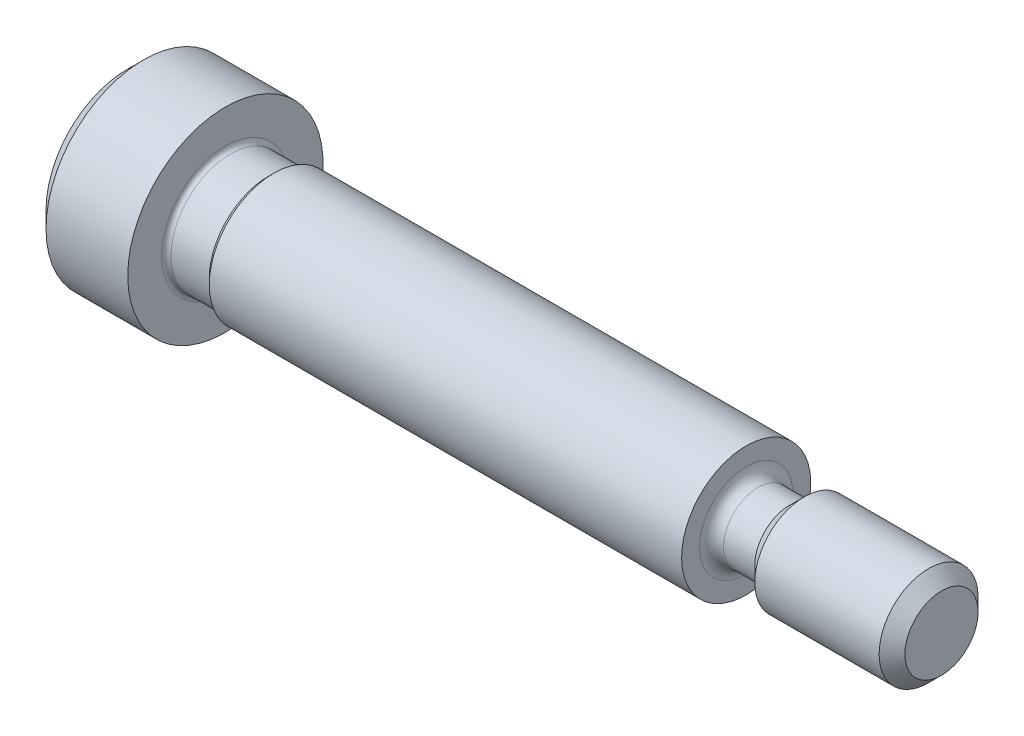
from build123d import *

# Parameters (mm, degrees)
HEX_2_DEPTH = 2.3876


# Read off the part's stored shape, not the designer's step: ThreadSchematic
with BuildPart() as part:
    # ThreadSchematic outline → ThreadSchematic (revolve)
    with BuildSketch(Plane.YX):
        with BuildLine():
            Line((0, 39.7002), (0, 0))
            Line((0, 0), (3.9751, 0))
            Line((3.9751, 0), (4.7625, 0.7874))
            Line((4.7625, 0.7874), (4.7625, 4.7752))
            Line((4.7625, 4.7752), (3.1115, 4.7752))
            ThreePointArc((3.1115, 4.7752), (2.94985539, 4.84215539), (2.8829, 5.0038))
            Line((2.8829, 5.0038), (2.8829, 6.8707))
            Line((2.8829, 6.8707), (3.1496, 7.1374))
            Line((3.1496, 7.1374), (3.1496, 30.1752))
            Line((3.1496, 30.1752), (2.2733, 30.1752))
            ThreePointArc((2.2733, 30.1752), (1.860208218, 30.346308218), (1.6891, 30.7594))
            Line((1.6891, 30.7594), (1.6891, 32.2834))
            Line((1.6891, 32.2834), (2.413, 33.0073))
            Line((2.413, 33.0073), (2.413, 39.07028))
            Line((2.413, 39.07028), (1.78308, 39.7002))
            Line((1.78308, 39.7002), (0, 39.7002))
        make_face()
    revolve(axis=Axis((0, 0, 0), (1, 0, 0)))

    # Sketch2 → PreBroach (revolve, cut)
    with BuildSketch(Plane.XY, mode=Mode.PRIVATE) as prebroach_sk:
        Polygon((0, 1.5875), (2.3876, 1.5875), (3.304143552, 0), (0, 0), align=None)
    revolve(prebroach_sk.sketch.rotate(Axis((0, 0, 0), (1, 0, 0)), 90), axis=Axis((0, 0, 0), (1, 0, 0)), mode=Mode.SUBTRACT)

    # Sketch3 → Hex 2 (cut)
    with BuildSketch(Plane.ZY):
        Polygon((-1.5875, -0.916543552), (-1.5875, 0.916543552), (0, 1.833087105), (1.5875, 0.916543552), (1.5875, -0.916543552), (0, -1.833087105), align=None)
    extrude(amount=-HEX_2_DEPTH, mode=Mode.SUBTRACT)


solid = part.part
